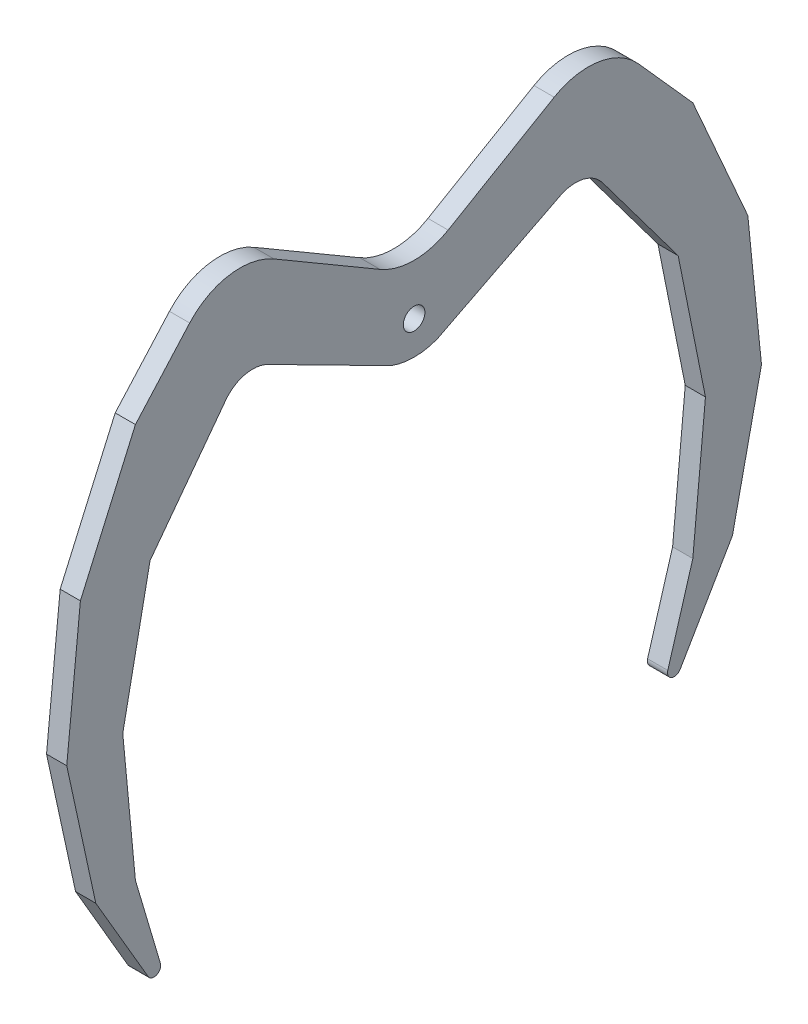
from build123d import *

# Parameters (mm, degrees)
SKETCH1_R           = 1.6
BOSS_EXTRUDE1_DEPTH = 3


with BuildPart() as part:
    # Sketch1 → Boss-Extrude1 (new body)
    with BuildSketch(Plane(origin=(0, 0, 0), x_dir=(0, 0, -1), z_dir=(1, 0, 0))):
        with BuildLine():
            Line((27.780848781, 17.066657307), (12.051707591, 7.859561741))
            ThreePointArc((12.051707591, 7.859561741), (7, 6.489755853), (1.948292409, 7.859561741))
            Line((1.948292409, 7.859561741), (-13.780848781, 17.066657307))
            ThreePointArc((-13.780848781, 17.066657307), (-20.390496118, 18.31435891), (-26.295266124, 15.092885895))
            Line((-26.295266124, 15.092885895), (-34.344007465, 6.069207081))
            Line((-34.344007465, 6.069207081), (-42.505034282, -12.494291235))
            Line((-42.505034282, -12.494291235), (-44.530195561, -32.671123252))
            Line((-44.530195561, -32.671123252), (-40.221254406, -52.486240072))
            Line((-40.221254406, -52.486240072), (-32.455672903, -65.79229085))
            ThreePointArc((-32.455672903, -65.79229085), (-31.195008966, -66.206062639), (-30.63323843, -65.004024984))
            Line((-30.63323843, -65.004024984), (-34.344007465, -52.486240072))
            Line((-34.344007465, -52.486240072), (-36.220260773, -32.671123252))
            Line((-36.220260773, -32.671123252), (-32.172003732, -12.494291235))
            Line((-32.172003732, -12.494291235), (-20.950903155, 2.498559727))
            ThreePointArc((-20.950903155, 2.498559727), (-18.083088579, 4.372010466), (-14.682448477, 3.959912168))
            Line((-14.682448477, 3.959912168), (3.579798567, -5.321886223))
            ThreePointArc((3.579798567, -5.321886223), (7, -5.953840799), (10.420201433, -5.321886223))
            Line((10.420201433, -5.321886223), (28.682448477, 3.959912168))
            ThreePointArc((28.682448477, 3.959912168), (32.083088579, 4.372010466), (34.950903155, 2.498559727))
            Line((34.950903155, 2.498559727), (46.172003732, -12.494291235))
            Line((46.172003732, -12.494291235), (50.220260773, -32.671123252))
            Line((50.220260773, -32.671123252), (48.344007465, -52.486240072))
            Line((48.344007465, -52.486240072), (44.63323843, -65.004024984))
            ThreePointArc((44.63323843, -65.004024984), (45.195008966, -66.206062639), (46.455672903, -65.79229085))
            Line((46.455672903, -65.79229085), (54.221254406, -52.486240072))
            Line((54.221254406, -52.486240072), (58.530195561, -32.671123252))
            Line((58.530195561, -32.671123252), (56.505034282, -12.494291235))
            Line((56.505034282, -12.494291235), (48.344007465, 6.069207081))
            Line((48.344007465, 6.069207081), (40.295266124, 15.092885895))
            ThreePointArc((40.295266124, 15.092885895), (34.390496118, 18.31435891), (27.780848781, 17.066657307))
        make_face()
        with Locations((7, -0.989579274)):
            Circle(SKETCH1_R, mode=Mode.SUBTRACT)
    extrude(amount=BOSS_EXTRUDE1_DEPTH)


solid = part.part
